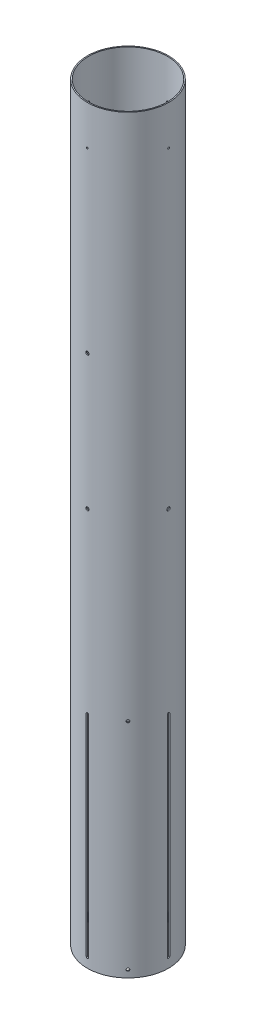
from build123d import *

# Parameters (mm, degrees)
SUSTAINER_TUBE_PROFILE_R       = 78.359
SUSTAINER_TUBE_PROFILE_R_2     = 76.2
SUSTAINER_TUBE_BODY_DEPTH      = 1447.8
FIN_SLOT_CUT_REACH             = 1460.364
FIN_SLOT_CUT_END_RADIUS        = 76.2
FIN_SLOT_PATTERN_COUNT         = 4
VENT_HOLE_DEPTH                = 1453.034815727
VENT_HOLE_DEPTH_BACK           = 1453.034815727
SKETCH2_R                      = 3.175
SKETCH3_R                      = 3.175
CUT_EXTRUDE3_DEPTH             = 1453.034815727
CIRPATTERN2_COUNT              = 4
CUT_EXTRUDE4_REACH             = 1462.107
CUT_EXTRUDE4_END_RADIUS        = 76.2
SKETCH4_R                      = 2.57937
CUT_EXTRUDE4_DIRECTION_2_DEPTH = 1461.106899298
CIRPATTERN3_COUNT              = 4


with BuildPart() as part:
    # Sustainer Tube Profile → Sustainer Tube Body (new body)
    with BuildSketch(Plane(origin=(0, 0, 0), x_dir=(1, 0, 0), z_dir=(0, 1, 0))):
        Circle(SUSTAINER_TUBE_PROFILE_R)
        Circle(SUSTAINER_TUBE_PROFILE_R_2, mode=Mode.SUBTRACT)
    extrude(amount=SUSTAINER_TUBE_BODY_DEPTH)

    # Fin Slot Cut: up to this cylinder (the profile starts outside it)
    fin_slot_cut_end = Plane(origin=(0, 222.25, 0), z_dir=(0, -1, 0)) * Cylinder(FIN_SLOT_CUT_END_RADIUS, 3074.128, mode=Mode.PRIVATE)
    # Fin Slot Profile → Fin Slot Cut (cut, up to the surface)
    with BuildSketch(Plane.XY.offset(78.359), mode=Mode.PRIVATE) as fin_slot_cut_sk1:
        with BuildLine():
            Line((-2.38125, 425.45), (-2.38125, 19.05))
            ThreePointArc((-2.38125, 19.05), (0, 16.66875), (2.38125, 19.05))
            Line((2.38125, 19.05), (2.38125, 425.45))
            ThreePointArc((2.38125, 425.45), (0, 427.83125), (-2.38125, 425.45))
        make_face()
    fin_slot_cut_tool1 = extrude(fin_slot_cut_sk1.sketch, amount=-FIN_SLOT_CUT_REACH, mode=Mode.PRIVATE) - fin_slot_cut_end
    fin_slot_cut = fin_slot_cut_tool1.solids().sort_by_distance((0, 222.25, 78.359))[0]
    add(fin_slot_cut, mode=Mode.SUBTRACT)

    # Fin Slot Pattern: Fin Slot Cut ×4 about axis
    fin_slot_pattern_axis = Axis((0, 1447.8, 0), (0, 1, 0))
    for i in range(1, FIN_SLOT_PATTERN_COUNT):
        add(fin_slot_cut.rotate(fin_slot_pattern_axis, i * 360 / FIN_SLOT_PATTERN_COUNT), mode=Mode.SUBTRACT)

    # Sketch2 → Vent Hole (cut, two sides: drawn at the far end of the back side and taken through both)
    with BuildSketch(Plane.XY.offset(-VENT_HOLE_DEPTH_BACK)):
        with Locations((0, 1028.7)):
            Circle(SKETCH2_R)
    extrude(amount=VENT_HOLE_DEPTH + VENT_HOLE_DEPTH_BACK, mode=Mode.SUBTRACT)

    # Sketch3 → Cut-Extrude3 (cut, symmetric)
    with BuildSketch(Plane.XY):
        with Locations((0, 768.35)):
            Circle(SKETCH3_R)
    cut_extrude3 = extrude(amount=CUT_EXTRUDE3_DEPTH, both=True, mode=Mode.SUBTRACT)

    # CirPattern2: Cut-Extrude3 ×4 about axis
    cirpattern2_axis = Axis((0, 1447.8, 0), (0, 1, 0))
    for i in range(1, CIRPATTERN2_COUNT):
        add(cut_extrude3.rotate(cirpattern2_axis, i * 360 / CIRPATTERN2_COUNT), mode=Mode.SUBTRACT)

    # Cut-Extrude4: up to this cylinder (the profile starts outside it)
    cut_extrude4_end = Plane(origin=(0, 221.74454, 0), z_dir=(0, -1, 0)) * Cylinder(CUT_EXTRUDE4_END_RADIUS, 3493.01068, mode=Mode.PRIVATE)
    # Sketch4 → Cut-Extrude4 (cut, up to the surface)
    with BuildSketch(Plane(origin=(55.408180267, 0, 55.408180267), x_dir=(0, -1, 0), z_dir=(0.7071067811865488, 0, 0.7071067811865464)), mode=Mode.PRIVATE) as cut_extrude4_sk1:
        with Locations((-14.0462, 0)):
            Circle(SKETCH4_R)
    cut_extrude4_tool1 = extrude(cut_extrude4_sk1.sketch, amount=-CUT_EXTRUDE4_REACH, mode=Mode.PRIVATE) - cut_extrude4_end
    add(cut_extrude4_tool1.solids().sort_by_distance((55.40818, 14.0462, 55.40818))[0], mode=Mode.SUBTRACT)
    # Sketch4 → Cut-Extrude4 (cut, up to the surface)
    with BuildSketch(Plane(origin=(55.408180267, 0, 55.408180267), x_dir=(0, -1, 0), z_dir=(0.7071067811865488, 0, 0.7071067811865464)), mode=Mode.PRIVATE) as cut_extrude4_sk2:
        with Locations((-429.44288, 0)):
            Circle(SKETCH4_R)
    cut_extrude4_tool2 = extrude(cut_extrude4_sk2.sketch, amount=-CUT_EXTRUDE4_REACH, mode=Mode.PRIVATE) - cut_extrude4_end
    add(cut_extrude4_tool2.solids().sort_by_distance((55.40818, 429.44288, 55.40818))[0], mode=Mode.SUBTRACT)

    # Sketch4 → Cut-Extrude4 direction 2 (cut)
    with BuildSketch(Plane(origin=(55.408180267, 0, 55.408180267), x_dir=(0, -1, 0), z_dir=(0.7071067811865488, 0, 0.7071067811865464))):
        with Locations((-14.0462, 0)):
            Circle(SKETCH4_R)
        with Locations((-429.44288, 0)):
            Circle(SKETCH4_R)
    extrude(amount=CUT_EXTRUDE4_DIRECTION_2_DEPTH, mode=Mode.SUBTRACT)

    # Sketch10 → #4 Clearance Hole1 (revolve, cut)
    with BuildSketch(Plane(origin=(0, 1371.6, 78.359), x_dir=(0, -1, 0), z_dir=(1, 0, 0))):
        Polygon((0, 0), (0, 5.806574487), (1.63195, 4.826), (1.63195, 0), align=None)
    f_4_clearance_hole1 = revolve(axis=Axis((0, 1371.6, 84.709), (0, 0, -1)), mode=Mode.SUBTRACT)

    # CirPattern3: #4 Clearance Hole1 ×4 about axis
    cirpattern3_axis = Axis((0, 1447.8, 0), (0, 1, 0))
    for i in range(1, CIRPATTERN3_COUNT):
        add(f_4_clearance_hole1.rotate(cirpattern3_axis, i * 360 / CIRPATTERN3_COUNT), mode=Mode.SUBTRACT)


solid = part.part
